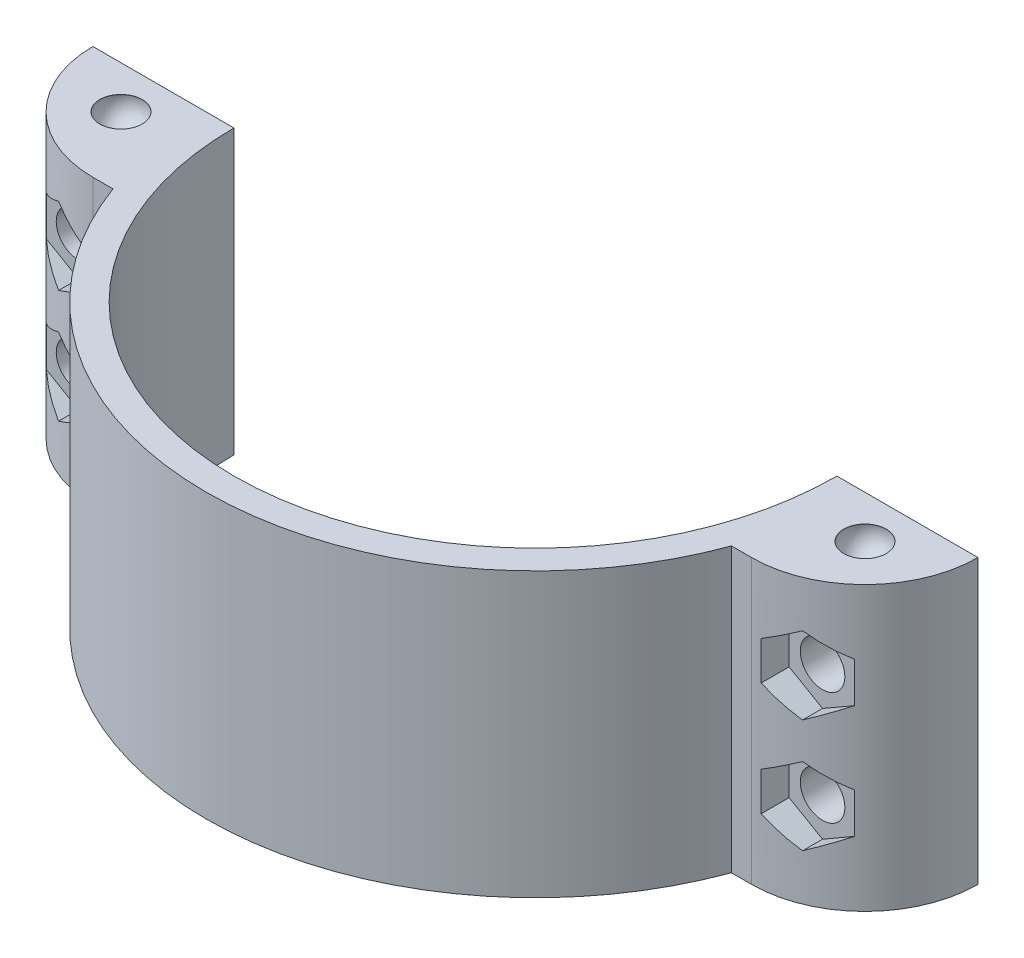
from build123d import *

# Parameters (mm, degrees)
BOSS_EXTRUDE5_DEPTH      = 12.7
BOSS_EXTRUDE5_DEPTH_BACK = 12.7
SKETCH6_R                = 2.000000064
CUT_EXTRUDE4_DEPTH       = 52.101224931
CUT_EXTRUDE5_START       = -7.62
CUT_EXTRUDE5_DEPTH       = 2.54
SKETCH9_R                = 1.905
BOSS_EXTRUDE9_DEPTH      = 0.0254
DOME3_FACE_RADIUS        = 1.905
DOME3_HEIGHT             = 2.286
DOME4_FACE_RADIUS        = 1.905
DOME4_HEIGHT             = 2.286
SKETCH10_R               = 1.905
CUT_EXTRUDE6_DEPTH       = 0.0254
DOME5_FACE_RADIUS        = 1.905
DOME5_HEIGHT             = 2.286
DOME6_FACE_RADIUS        = 1.905
DOME6_HEIGHT             = 2.286
BOSS_EXTRUDE10_START     = -28
BOSS_EXTRUDE10_DEPTH     = 9.812276711
BOSS_EXTRUDE10_START_2   = -6
BOSS_EXTRUDE10_2_DEPTH   = 12
CUT_EXTRUDE7_DEPTH       = 10.414
CUT_EXTRUDE7_DEPTH_BACK  = 10.414
SKETCH13_R               = 22.86


with BuildPart() as part:
    # Sketch3 → Boss-Extrude5 (new, two sides: drawn at the far end of the back side and taken through both)
    with BuildSketch(Plane(origin=(0, 0, 0), x_dir=(-1, 0, 0), z_dir=(0, -1, 0)).offset(-BOSS_EXTRUDE5_DEPTH_BACK)):
        with BuildLine():
            Line((27.051, 0), (29.549701049, 0))
            Line((29.549701049, 0), (39.709701049, 0))
            ThreePointArc((39.709701049, 0), (36.733905946, -7.184204897), (29.549701049, -10.16))
            Line((29.549701049, -10.16), (27.748139255, -10.16))
            ThreePointArc((27.748139255, -10.16), (0, -29.549701049), (-27.748139255, -10.16))
            Line((-27.748139255, -10.16), (-29.549701049, -10.16))
            ThreePointArc((-29.549701049, -10.16), (-36.733905946, -7.184204897), (-39.709701049, 0))
            Line((-39.709701049, 0), (-29.549701049, 0))
            Line((-29.549701049, 0), (-27.051, 0))
            ThreePointArc((-27.051, 0), (0, -27.051), (27.051, 0))
        make_face()
    extrude(amount=BOSS_EXTRUDE5_DEPTH + BOSS_EXTRUDE5_DEPTH_BACK)

    # Sketch6 → Cut-Extrude4 (cut, through all)
    with BuildSketch(Plane(origin=(0, 0, 0), x_dir=(-1, 0, 0), z_dir=(0, 0, -1))):
        with Locations((-33.380350525, 5.08)):
            Circle(SKETCH6_R)
        with Locations((-33.380350525, -5.08)):
            Circle(SKETCH6_R)
        with Locations((33.380350525, 5.08)):
            Circle(SKETCH6_R)
        with Locations((33.380350525, -5.08)):
            Circle(SKETCH6_R)
    extrude(amount=-CUT_EXTRUDE4_DEPTH, mode=Mode.SUBTRACT)

    # Sketch7 → Cut-Extrude5 (cut)
    with BuildSketch(Plane(origin=(0, 0, 0), x_dir=(-1, 0, 0), z_dir=(0, 0, -1)).offset(CUT_EXTRUDE5_START)):
        Polygon((-30.380350525, 6.812050808), (-33.380350525, 8.544101615), (-36.380350525, 6.812050808), (-36.380350525, 3.347949192), (-33.380350525, 1.615898385), (-30.380350525, 3.347949192), align=None)
        Polygon((-30.380350525, -3.347949192), (-33.380350525, -1.615898385), (-36.380350525, -3.347949192), (-36.380350525, -6.812050808), (-33.380350525, -8.544101615), (-30.380350525, -6.812050808), align=None)
        Polygon((36.380350525, 6.812050808), (33.380350525, 8.544101615), (30.380350525, 6.812050808), (30.380350525, 3.347949192), (33.380350525, 1.615898385), (36.380350525, 3.347949192), align=None)
        Polygon((36.380350525, -3.347949192), (33.380350525, -1.615898385), (30.380350525, -3.347949192), (30.380350525, -6.812050808), (33.380350525, -8.544101615), (36.380350525, -6.812050808), align=None)
    extrude(amount=-CUT_EXTRUDE5_DEPTH, mode=Mode.SUBTRACT)

    # Sketch9 → Boss-Extrude9 (add)
    with BuildSketch(Plane(origin=(0, -12.7, 0), x_dir=(-1, 0, 0), z_dir=(0, -1, 0))):
        with Locations(Location((-33.380350525, -3.81, 0), (0, 0, 90))):
            Circle(SKETCH9_R)
        with Locations(Location((33.380350525, -3.81, 0), (0, 0, 90))):
            Circle(SKETCH9_R)
    extrude(amount=BOSS_EXTRUDE9_DEPTH)

    # Dome3: a dome of height H over a round flat face of radius A is a cap of a sphere of radius (A * A + H * H) / (2 * H)
    dome3_r = (DOME3_FACE_RADIUS * DOME3_FACE_RADIUS + DOME3_HEIGHT * DOME3_HEIGHT) / (2 * DOME3_HEIGHT)
    dome3_base = Plane((33.380350525, -12.7254, 3.81), z_dir=(0, -1, 0))
    with Locations(dome3_base.offset(DOME3_HEIGHT - dome3_r)):
        dome3_ball = Sphere(dome3_r, mode=Mode.PRIVATE)
    add(split(dome3_ball, bisect_by=dome3_base, keep=Keep.TOP, mode=Mode.PRIVATE))

    # Dome4: a dome of height H over a round flat face of radius A is a cap of a sphere of radius (A * A + H * H) / (2 * H)
    dome4_r = (DOME4_FACE_RADIUS * DOME4_FACE_RADIUS + DOME4_HEIGHT * DOME4_HEIGHT) / (2 * DOME4_HEIGHT)
    dome4_base = Plane((-33.380350525, -12.7254, 3.81), z_dir=(0, -1, 0))
    with Locations(dome4_base.offset(DOME4_HEIGHT - dome4_r)):
        dome4_ball = Sphere(dome4_r, mode=Mode.PRIVATE)
    add(split(dome4_ball, bisect_by=dome4_base, keep=Keep.TOP, mode=Mode.PRIVATE))

    # Sketch10 → Cut-Extrude6 (cut)
    with BuildSketch(Plane(origin=(0, 12.7, 0), x_dir=(1, 0, 0), z_dir=(0, 1, 0))):
        with Locations(Location((33.380350525, -3.81, 0), (0, 0, 90))):
            Circle(SKETCH10_R)
        with Locations(Location((-33.380350525, -3.81, 0), (0, 0, 90))):
            Circle(SKETCH10_R)
    extrude(amount=-CUT_EXTRUDE6_DEPTH, mode=Mode.SUBTRACT)

    # Dome5: a dome of height H over a round flat face of radius A is a cap of a sphere of radius (A * A + H * H) / (2 * H)
    dome5_r = (DOME5_FACE_RADIUS * DOME5_FACE_RADIUS + DOME5_HEIGHT * DOME5_HEIGHT) / (2 * DOME5_HEIGHT)
    dome5_base = Plane((33.380350525, 12.6746, 3.81), z_dir=(0, -1, 0))
    with Locations(dome5_base.offset(DOME5_HEIGHT - dome5_r)):
        dome5_ball = Sphere(dome5_r, mode=Mode.PRIVATE)
    add(split(dome5_ball, bisect_by=dome5_base, keep=Keep.TOP, mode=Mode.PRIVATE), mode=Mode.SUBTRACT)

    # Dome6: a dome of height H over a round flat face of radius A is a cap of a sphere of radius (A * A + H * H) / (2 * H)
    dome6_r = (DOME6_FACE_RADIUS * DOME6_FACE_RADIUS + DOME6_HEIGHT * DOME6_HEIGHT) / (2 * DOME6_HEIGHT)
    dome6_base = Plane((-33.380350525, 12.6746, 3.81), z_dir=(0, -1, 0))
    with Locations(dome6_base.offset(DOME6_HEIGHT - dome6_r)):
        dome6_ball = Sphere(dome6_r, mode=Mode.PRIVATE)
    add(split(dome6_ball, bisect_by=dome6_base, keep=Keep.TOP, mode=Mode.PRIVATE), mode=Mode.SUBTRACT)

    # Boss-Extrude10: read off the stored shape, not the designer's step
    # Boss-Extrude10 outline → Boss-Extrude10 (add)
    with BuildSketch(Plane(origin=(0, 0, 0), x_dir=(-1, 0, 0), z_dir=(0, 0, -1)).offset(BOSS_EXTRUDE10_START)):
        with BuildLine():
            add(Edge.make_bspline(
                [(5.08, 0), (5.08, -1.345643562), (4.526719274, -2.65770318), (2.656649507, -4.527337736), (1.331455476, -5.079221738), (-1.32551012, -5.080776522), (-2.646103693, -4.537670622), (-4.536464951, -2.648170155), (-5.07946682, -1.329666265), (-5.080532362, 1.325589104), (-4.531084206, 2.651405113), (-2.659686169, 4.526228301), (-1.345855952, 5.079004988), (1.338333997, 5.080992228), (2.654502959, 4.528337308), (4.524460769, 2.661104937), (5.08, 1.345643562), (5.08, 0)],
                knots=[0, 0, 0, 0, 0.125, 0.125, 0.25, 0.25, 0.375, 0.375, 0.5, 0.5, 0.625, 0.625, 0.75, 0.75, 0.875, 0.875, 1, 1, 1, 1], degree=3))
        make_face()
    extrude(amount=BOSS_EXTRUDE10_DEPTH)

    # Boss-Extrude10 2 outline → Boss-Extrude10 2 (cut)
    with BuildSketch(Plane(origin=(0, 0, 0), x_dir=(1, 0, 0), z_dir=(0, 1, 0)).offset(BOSS_EXTRUDE10_START_2)):
        with BuildLine():
            Line((5.080000094, -18.187723372), (-5.080000481, -18.187723298))
            ThreePointArc((-5.080000481, -18.187723298), (-1.97e-07, -18.669), (5.080000094, -18.187723372))
        make_face()
    extrude(amount=BOSS_EXTRUDE10_2_DEPTH, mode=Mode.SUBTRACT)

    # Sketch13 → Cut-Extrude7 (cut, two sides: drawn at the far end of the back side and taken through both)
    with BuildSketch(Plane(origin=(0, 0, 0), x_dir=(1, 0, 0), z_dir=(0, 1, 0)).offset(-CUT_EXTRUDE7_DEPTH_BACK)):
        Circle(SKETCH13_R)
    extrude(amount=CUT_EXTRUDE7_DEPTH + CUT_EXTRUDE7_DEPTH_BACK, mode=Mode.SUBTRACT)


solid = part.part
